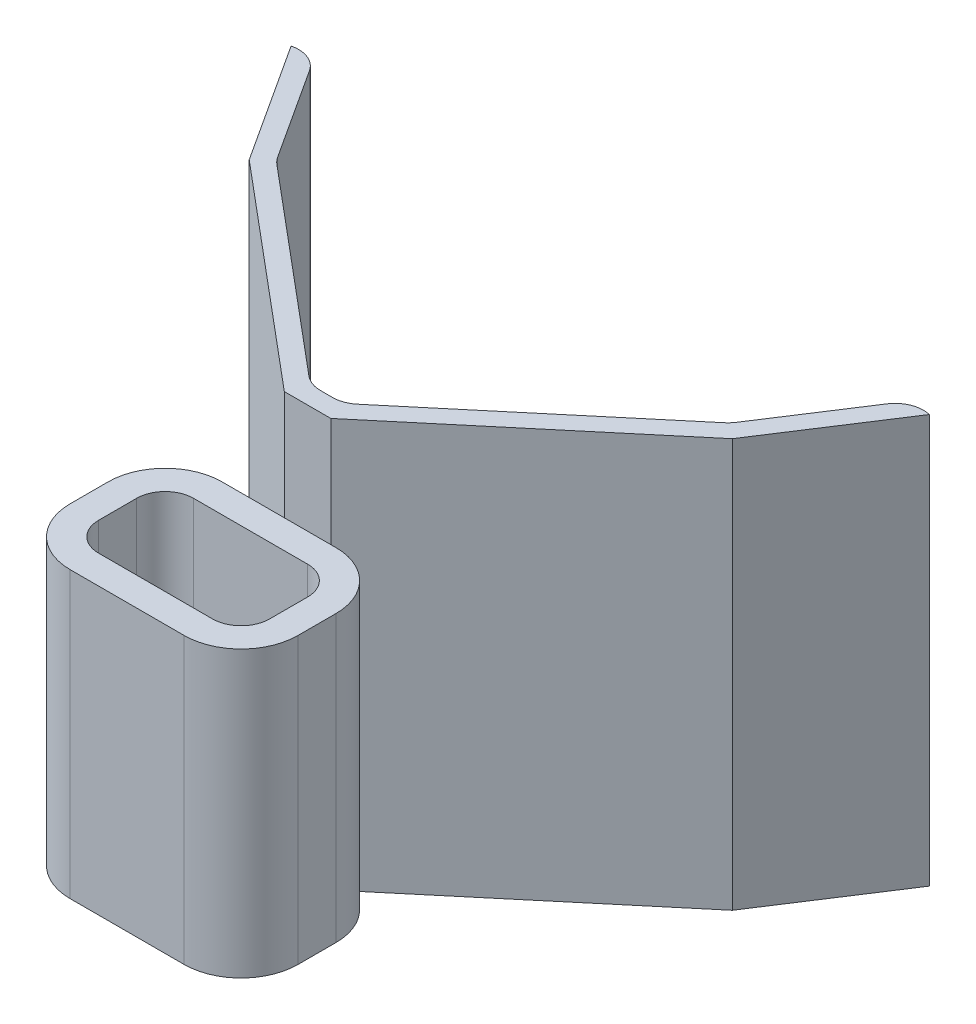
from build123d import *

# Parameters (mm, degrees)
SALIENTE_EXTRUIR1_DEPTH = 30
CROQUIS3_W              = 4.89350096
CROQUIS3_H              = 4.01782184
SALIENTE_EXTRUIR2_DEPTH = 3
SALIENTE_EXTRUIR3_DEPTH = 21.5
REDONDEO2_R             = 3


with BuildPart() as part:
    # Croquis1 → Saliente-Extruir1 (new body)
    with BuildSketch(Plane(origin=(0, 0, 0), x_dir=(1, 0, 0), z_dir=(0, 1, 0))):
        with BuildLine():
            Line((-6, 8), (6, 8))
            ThreePointArc((6, 8), (10.242640687, 6.242640687), (12, 2))
            Line((12, 2), (12, -2))
            ThreePointArc((12, -2), (10.242640687, -6.242640687), (6, -8))
            Line((6, -8), (-6, -8))
            ThreePointArc((-6, -8), (-10.242640687, -6.242640687), (-12, -2))
            Line((-12, -2), (-12, 2))
            ThreePointArc((-12, 2), (-10.242640687, 6.242640687), (-6, 8))
        make_face()
        with BuildLine():
            Line((-6, -5), (6, -5))
            ThreePointArc((6, -5), (8.121320344, -4.121320344), (9, -2))
            Line((9, -2), (9, 2))
            ThreePointArc((9, 2), (8.121320344, 4.121320344), (6, 5))
            Line((6, 5), (-6, 5))
            ThreePointArc((-6, 5), (-8.121320344, 4.121320344), (-9, 2))
            Line((-9, 2), (-9, -2))
            ThreePointArc((-9, -2), (-8.121320344, -4.121320344), (-6, -5))
        make_face(mode=Mode.SUBTRACT)
    extrude(amount=SALIENTE_EXTRUIR1_DEPTH)

    # Croquis3 → Saliente-Extruir2 (add)
    with BuildSketch(Plane(origin=(0, 0, -8), x_dir=(-1, 0, 0), z_dir=(0, 0, -1))):
        with Locations((0, 15)):
            Rectangle(CROQUIS3_W, CROQUIS3_H)
    extrude(amount=SALIENTE_EXTRUIR2_DEPTH)

    # Croquis7 → Saliente-Extruir3 (add, symmetric)
    with BuildSketch(Plane(origin=(0, 17.00891092, 0), x_dir=(1, 0, 0), z_dir=(0, 1, 0))):
        Polygon((-2.44675048, 11), (2.44675048, 11), (25.428083774, 30.283628291), (33.597669299, 42.86368681), (31.920328163, 43.95296488), (23.913536336, 31.623586673), (1.718810011, 13), (-1.718810011, 13), (-23.913536336, 31.623586673), (-31.920328163, 43.95296488), (-33.597669299, 42.86368681), (-25.428083774, 30.283628291), align=None)
    extrude(amount=SALIENTE_EXTRUIR3_DEPTH, both=True)

    # Redondeo2
    # the kernel refuses this fillet: 3 mm, written as the material it adds along each edge
    with BuildSketch(Plane(origin=(-23.913536336, -4.49108908, -31.623586673), x_dir=(0.7660444431189832, 0, 0.6427876096865331), z_dir=(0, 1, 0)), Plane(origin=(23.913536336, -4.49108908, -31.623586673), x_dir=(0.5446390350150309, 0, -0.8386705679454215), z_dir=(0, 1, 0))) as redondeo2_piece_1:
        with BuildLine():
            CenterArc((REDONDEO2_R * 0.149451001349, REDONDEO2_R), REDONDEO2_R, 253, 17)
            Line((-REDONDEO2_R * 0.142920703374, REDONDEO2_R * 0.043695244037), (0, 0))
            Line((0, 0), (REDONDEO2_R * 0.149451001349, 0))
        make_face()
    extrude(amount=43)
    with BuildSketch(Plane(origin=(1.718810011, -4.49108908, -13), x_dir=(0.7660444431189833, 0, -0.6427876096865328), z_dir=(0, 1, 0)), Plane(origin=(-1.718810011, -4.49108908, -13), x_dir=(1, 0, 0), z_dir=(0, 1, 0))) as redondeo2_piece_2:
        with BuildLine():
            CenterArc((REDONDEO2_R * 0.363970234266, REDONDEO2_R), REDONDEO2_R, 230, 40)
            Line((-REDONDEO2_R * 0.27881737542, REDONDEO2_R * 0.233955556881), (0, 0))
            Line((0, 0), (REDONDEO2_R * 0.363970234266, 0))
        make_face()
    extrude(amount=43)
    # the kernel refuses this fillet: 3 mm, written as the material it takes off along each edge
    with BuildSketch(Plane(origin=(31.920328163, -11.562156891, -43.95296488), x_dir=(0.8386705679454225, 0, 0.5446390350150296), z_dir=(0, 1, 0))) as redondeo2_2_piece_1:
        with BuildLine():
            CenterArc((3, -2.828427125), REDONDEO2_R, 109.471220634, 70.528779366)
            Line((0, -2.828427125), (0, 0))
            Line((0, 0), (2, 0))
        make_face()
    extrude(amount=57.142135624, mode=Mode.SUBTRACT)
    with BuildSketch(Plane(origin=(-31.920328163, -11.562156891, -43.95296488), x_dir=(0.5446390350150306, 0, 0.8386705679454217), z_dir=(0, 1, 0))) as redondeo2_2_piece_2:
        with BuildLine():
            CenterArc((2.828427125, -3), REDONDEO2_R, 90, 70.528779366)
            Line((0, -2), (0, 0))
            Line((0, 0), (2.828427125, 0))
        make_face()
    extrude(amount=57.142135624, mode=Mode.SUBTRACT)


solid = part.part
